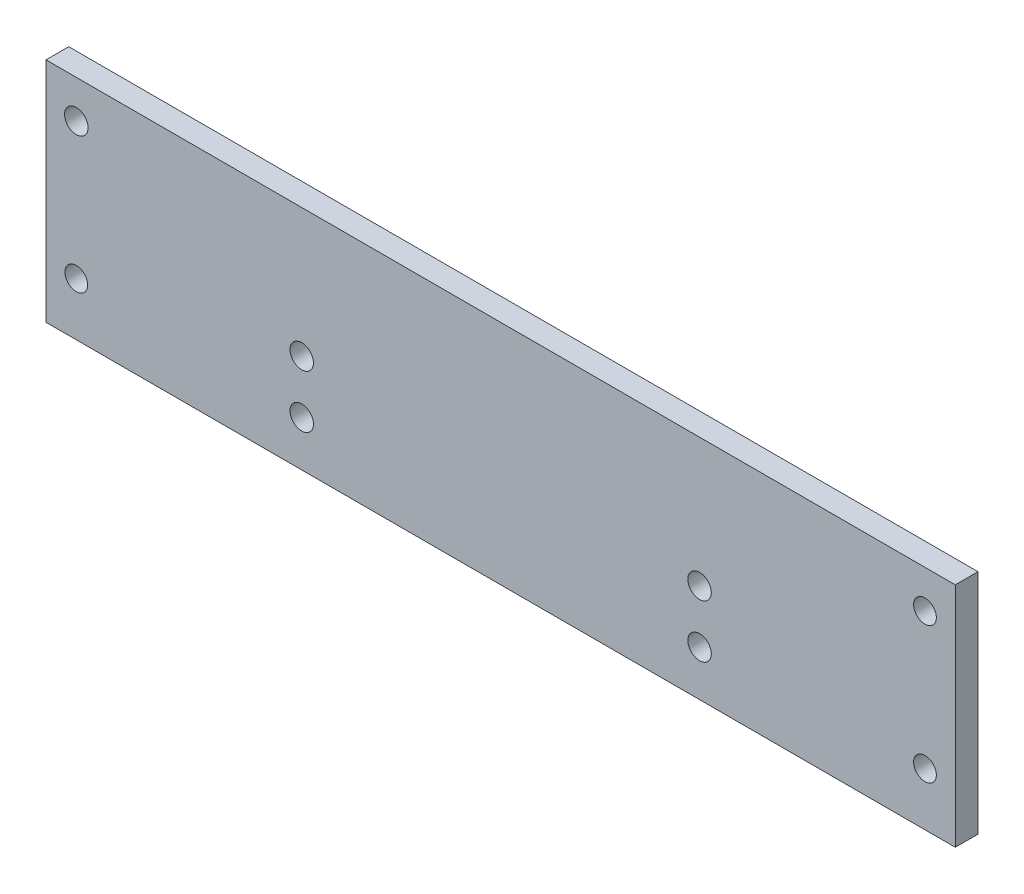
from build123d import *

# Parameters (mm, degrees)
SKETCH_1_W          = 120
SKETCH_1_H          = 30
EXTRUDE_1_DEPTH     = 3
SKETCH_3_R          = 1.5
SKETCH_3_R_2        = 1.55
CUT_EXTRUDE_2_DEPTH = 10
SKETCH_6_R          = 1.5
CUT_EXTRUDE_3_DEPTH = 10
SKETCH_4_R          = 1.55
CUT_EXTRUDE_4_DEPTH = 62.919302322


with BuildPart() as part:
    # 草图1 → 凸台-拉伸1 (new body)
    with BuildSketch(Plane.XY):
        Rectangle(SKETCH_1_W, SKETCH_1_H)
    extrude(amount=EXTRUDE_1_DEPTH)

    # 草图3 → 切除-拉伸2 (cut)
    with BuildSketch(Plane(origin=(0, 0, 0), x_dir=(-1, 0, 0), z_dir=(0, 0, -1))):
        with Locations((-56, 10)):
            Circle(SKETCH_3_R)
        with Locations((56, 10)):
            Circle(SKETCH_3_R_2)
    extrude(amount=-CUT_EXTRUDE_2_DEPTH, mode=Mode.SUBTRACT)

    # 草图6 → 切除-拉伸3 (cut)
    with BuildSketch(Plane.XY.offset(3)):
        with Locations((-56, -8)):
            Circle(SKETCH_6_R)
        with Locations((56, -8)):
            Circle(SKETCH_6_R)
    extrude(amount=-CUT_EXTRUDE_3_DEPTH, mode=Mode.SUBTRACT)

    # 草图4 → 切除-拉伸4 (cut, through all)
    with BuildSketch(Plane.XY.offset(3)):
        with Locations((-26.25, -2)):
            Circle(SKETCH_4_R)
        with Locations((-26.25, -9)):
            Circle(SKETCH_4_R)
        with Locations((26.25, -9)):
            Circle(SKETCH_4_R)
        with Locations((26.25, -2)):
            Circle(SKETCH_4_R)
    extrude(amount=-CUT_EXTRUDE_4_DEPTH, mode=Mode.SUBTRACT)


solid = part.part
